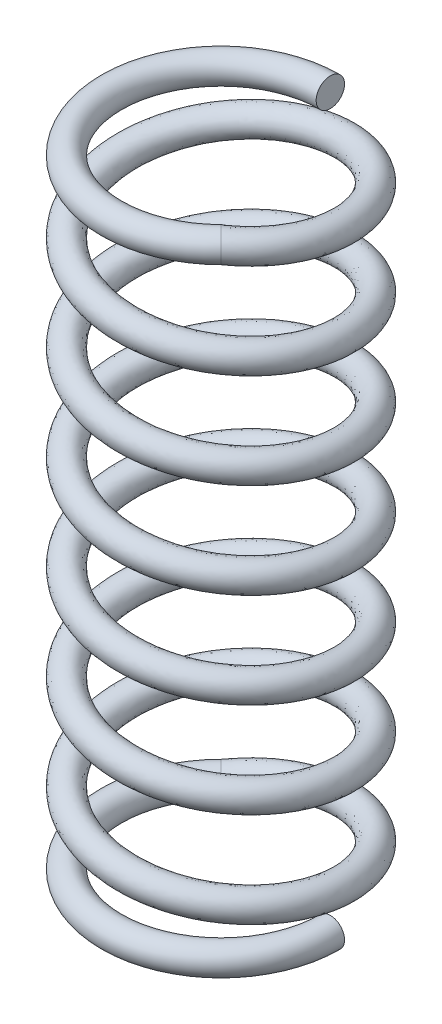
from build123d import *

# Parameters (mm, degrees)
SWEEP2_PITCH       = 3.846153846
SWEEP2_HEIGHT      = 25
SWEEP2_RADIUS      = 5
SWEEP2_START_ANGLE = -135
SKETCH2_R          = 0.575
SKETCH6_R          = 0.575
SKETCH8_R          = 0.575


with BuildPart() as part:
    # Sweep2: sweep along a helix
    with BuildLine() as sweep2_path:
        add(Helix(SWEEP2_PITCH, SWEEP2_HEIGHT, SWEEP2_RADIUS, center=(0, 0, 0), direction=(0, 1, 0), lefthand=True, mode=Mode.PRIVATE).rotate(Axis((0, 0, 0), (0, 1, 0)), SWEEP2_START_ANGLE))
    # Sketch2 → Sweep2 (sweep)
    with BuildSketch(Plane(origin=(0, 0, 0), x_dir=(0, 0, -1), z_dir=(1, 0, 0))):
        with Locations((4.425, 0.24561009)):
            Circle(SKETCH2_R)
    sweep(path=sweep2_path.line, is_frenet=True)

    # Sweep3: sweep along a path in Sketch5
    with BuildLine(Plane(origin=(0, 24.764840823, 0), x_dir=(1, 0, 0), z_dir=(0, 1, 0))) as sweep3_path:
        ThreePointArc((0, 4.425), (-4.088166882, -1.693374308), (3.128947691, -3.128947323))
    # Sketch6 → Sweep3 (sweep)
    with BuildSketch(Plane(origin=(0, 0, 0), x_dir=(0.7071068227462004, 0, 0.7071067396268922), z_dir=(-0.7071067396268922, 0, 0.7071068227462004))):
        with Locations((4.425, 24.764840823)):
            Circle(SKETCH6_R)
    sweep(path=sweep3_path.line)

    # Sweep4: sweep along a path in Sketch7
    with BuildLine(Plane(origin=(0, -0.235159177, 0), x_dir=(1, 0, 0), z_dir=(0, 1, 0))) as sweep4_path:
        ThreePointArc((-3.128947507, 3.128947507), (-1.693374188, -4.088166931), (4.425, 0))
    # Sketch8 → Sweep4 (sweep)
    with BuildSketch(Plane(origin=(0, 0, 0), x_dir=(0.7071068227462004, 0, 0.7071067396268922), z_dir=(-0.7071067396268922, 0, 0.7071068227462004))):
        with Locations((-4.425, -0.235159177)):
            Circle(SKETCH8_R)
    sweep(path=sweep4_path.line)


solid = part.part
